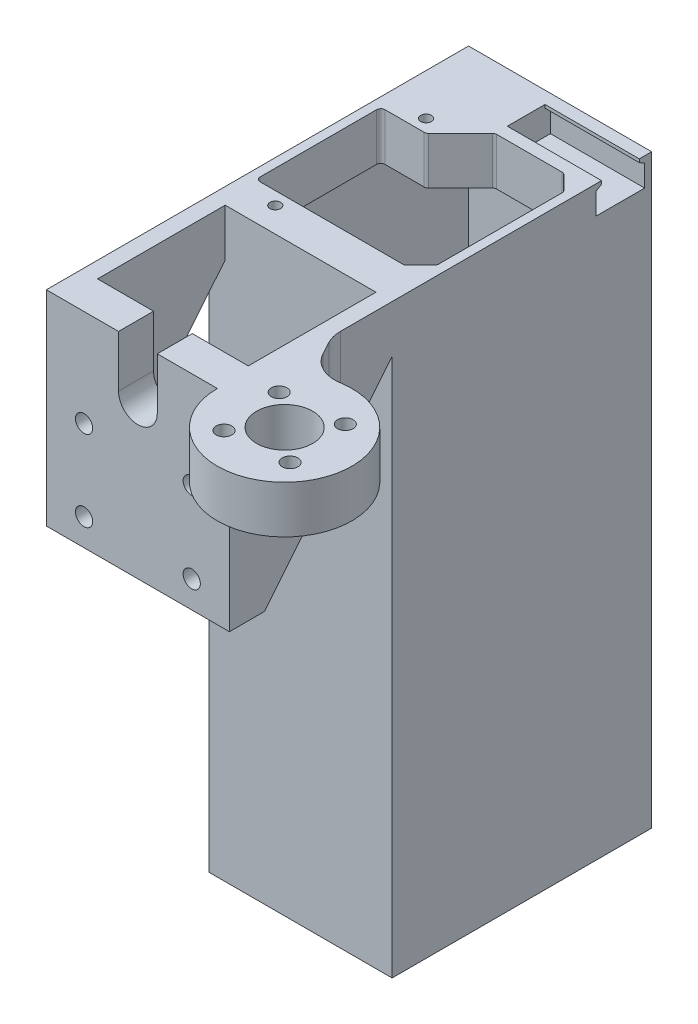
from build123d import *

# Parameters (mm, degrees)
BOSS_EXTRUDE1_START      = -1
SKETCH1_W                = 1.7
SKETCH1_H                = 89.2
BOSS_EXTRUDE1_DEPTH      = 8.8
SKETCH4_W                = 33.7
SKETCH4_H                = 11.6
BOSS_EXTRUDE3_DEPTH      = 8.8
SERVO_HOLDER_DEPTH       = 1
SERVO_HOLDER_DEPTH_BACK  = 8.8
SKETCH3_W                = 14
SKETCH3_H                = 7
SKETCH3_R                = 1
SKETCH37_W               = 20
SKETCH37_H               = 7
BOSS_EXTRUDE19_DEPTH     = 9.8
CUT_EXTRUDE10_DEPTH      = 93.434679639
CUT_EXTRUDE10_DEPTH_BACK = 93.434679639
SKETCH29_W               = 34.409909993
SKETCH29_H               = 6.377389624
BOSS_EXTRUDE13_START     = 2
SKETCH30_W               = 34
SKETCH30_H               = 38
SKETCH30_R               = 1.6
BOSS_EXTRUDE13_DEPTH     = 6.5
SKETCH41_W               = 17.288461538
SKETCH41_H               = 8.8
CUT_EXTRUDE14_DEPTH      = 15
BOSS_EXTRUDE14_START     = -38
SKETCH32_R               = 1.45
SKETCH32_R_2             = 5.2
BOSS_EXTRUDE14_DEPTH     = 8.8
BOSS_EXTRUDE16_DEPTH     = 3
BOSS_EXTRUDE17_DEPTH     = 3
BOSS_EXTRUDE18_DEPTH     = 8.8
SKETCH39_W               = 1.7
SKETCH39_H               = 41.2
BOSS_EXTRUDE20_DEPTH     = 8.8
CUT_EXTRUDE13_DEPTH      = 17.5
CHAMFER2_SIZE            = 0.6
CHAMFER2_SIZE_2          = 1.039230485
CHAMFER3_SIZE            = 3
FILLET10_R               = 6
CUT_EXTRUDE15_DEPTH      = 10
CHAMFER4_SIZE            = 2.5
CUT_EXTRUDE16_DEPTH      = 10
FILLET11_R               = 0.8
SKETCH44_W               = 34
SKETCH44_H               = 48.2
SKETCH44_W_2             = 31.2
SKETCH44_H_2             = 45.4
BOSS_EXTRUDE21_DEPTH     = 100


with BuildPart() as part:
    # Sketch1 → Boss-Extrude1 (new body)
    with BuildSketch(Plane(origin=(0, 0, 0), x_dir=(1, 0, 0), z_dir=(0, 1, 0)).offset(BOSS_EXTRUDE1_START)):
        with Locations((-20.85, 25.311538462)):
            Rectangle(SKETCH1_W, SKETCH1_H)
    extrude(amount=-BOSS_EXTRUDE1_DEPTH)

    # Sketch4 → Boss-Extrude3 (add)
    with BuildSketch(Plane.XZ.offset(9.8)):
        with Locations((-4.85, -64.111538462)):
            Rectangle(SKETCH4_W, SKETCH4_H)
    extrude(amount=-BOSS_EXTRUDE3_DEPTH)

    # Sketch3 → Servo Holder (add, two sides: drawn at the far end of the back side and taken through both)
    # profile 1 of 2: a face of its own
    with BuildSketch(Plane.XZ.offset(9.8).offset(-SERVO_HOLDER_DEPTH_BACK)):
        with Locations((-14.7, -55.411538462)):
            Rectangle(SKETCH3_W, SKETCH3_H)
        with Locations(Location((-14, -54.311538462, 0), (0, 0, 270))):
            Circle(SKETCH3_R, mode=Mode.SUBTRACT)
    # profile 2 of 2: a face of its own
    with BuildSketch(Plane.XZ.offset(9.8).offset(-SERVO_HOLDER_DEPTH_BACK)):
        with Locations((-14.7, -25.211538462)):
            Rectangle(SKETCH3_W, SKETCH3_H)
        with Locations(Location((-14, -26.311538462, 0), (0, 0, 90))):
            Circle(SKETCH3_R, mode=Mode.SUBTRACT)
    extrude(amount=SERVO_HOLDER_DEPTH + SERVO_HOLDER_DEPTH_BACK)

    # Sketch37 → Boss-Extrude19 (add)
    with BuildSketch(Plane(origin=(0, -1, 0), x_dir=(1, 0, 0), z_dir=(0, 1, 0))):
        with Locations((2.3, 25.211538462)):
            Rectangle(SKETCH37_W, SKETCH37_H)
    extrude(amount=-BOSS_EXTRUDE19_DEPTH)

    # Sketch29 → Cut-Extrude10 (cut, two sides: drawn at the far end of the back side and taken through both)
    with BuildSketch(Plane(origin=(0, 0, -69.911538462), x_dir=(-1, 0, 0), z_dir=(0, 0, -1)).offset(-CUT_EXTRUDE10_DEPTH_BACK)):
        with Locations((4.495045004, -12.988694812)):
            Rectangle(SKETCH29_W, SKETCH29_H)
    extrude(amount=CUT_EXTRUDE10_DEPTH + CUT_EXTRUDE10_DEPTH_BACK, mode=Mode.SUBTRACT)


with BuildPart() as body_2:
    # Sketch30 → Boss-Extrude13 (new body)
    with BuildSketch(Plane.XY.offset(BOSS_EXTRUDE13_START)):
        with Locations((-4.7, -20)):
            Rectangle(SKETCH30_W, SKETCH30_H)
        with Locations(Location((5.3, -34, 0), (0, 0, 180))):
            Circle(SKETCH30_R, mode=Mode.SUBTRACT)
        with Locations(Location((5.3, -19, 0), (0, 0, 180))):
            Circle(SKETCH30_R, mode=Mode.SUBTRACT)
        with Locations(Location((-14.7, -34, 0), (0, 0, 180))):
            Circle(SKETCH30_R, mode=Mode.SUBTRACT)
        with Locations(Location((-14.7, -19, 0), (0, 0, 180))):
            Circle(SKETCH30_R, mode=Mode.SUBTRACT)
    extrude(amount=BOSS_EXTRUDE13_DEPTH)


with BuildPart() as cut_extrude14_tool:
    # Sketch41 → Cut-Extrude14 (new body)
    with BuildSketch(Plane(origin=(-20, 0, 0), x_dir=(0, 0, -1), z_dir=(1, 0, 0))):
        with Locations((-10.644230769, -5.4)):
            Rectangle(SKETCH41_W, SKETCH41_H)
    extrude(amount=-CUT_EXTRUDE14_DEPTH)


with BuildPart() as part_1:
    add(part.part)

    # Cut-Extrude14: cut by cut_extrude14_tool
    add(cut_extrude14_tool.part, mode=Mode.SUBTRACT)



with BuildPart() as body_2_1:
    add(body_2.part)

    # Cut-Extrude14: cut by cut_extrude14_tool
    add(cut_extrude14_tool.part, mode=Mode.SUBTRACT)

    # Sketch32 → Boss-Extrude14 (add)
    with BuildSketch(Plane.XZ.offset(39).offset(BOSS_EXTRUDE14_START)):
        with BuildLine():
            ThreePointArc((11.872921748, 2), (25.925390485, -3.535644523), (35.05, 8.5))
            ThreePointArc((35.05, 8.5), (22.55, 21), (10.05, 8.5))
            Line((10.05, 8.5), (12.3, 8.5))
            Line((12.3, 8.5), (12.3, 2))
            Line((12.3, 2), (11.872921748, 2))
        make_face()
        with Locations(Location((16.410078628, 3.371514303, 0), (0, 0, 180))):
            Circle(SKETCH32_R, mode=Mode.SUBTRACT)
        with Locations(Location((27.678485697, 2.360078628, 0), (0, 0, 180))):
            Circle(SKETCH32_R, mode=Mode.SUBTRACT)
        with Locations(Location((17.421514303, 14.639921372, 0), (0, 0, 180))):
            Circle(SKETCH32_R, mode=Mode.SUBTRACT)
        with Locations(Location((22.55, 8.5, 0), (0, 0, 180))):
            Circle(SKETCH32_R_2, mode=Mode.SUBTRACT)
        with Locations(Location((28.689921372, 13.628485697, 0), (0, 0, 180))):
            Circle(SKETCH32_R, mode=Mode.SUBTRACT)
    extrude(amount=BOSS_EXTRUDE14_DEPTH)


with BuildPart() as part_2:
    add(part_1.part)

    add(body_2_1.part)  # Boss-Extrude16 merges body 2
    # Sketch34 → Boss-Extrude16 (add)
    with BuildSketch(Plane.ZY.offset(21.7)):
        Polygon((-21.711538462, -1), (-21.711538462, -9.8), (2, -39), (8.5, -39), (8.5, -1), align=None)
    extrude(amount=-BOSS_EXTRUDE16_DEPTH)

    # Sketch35 → Boss-Extrude17 (add)
    with BuildSketch(Plane(origin=(12.3, 0, 0), x_dir=(0, 0, -1), z_dir=(1, 0, 0))):
        Polygon((-2, -1), (21.711538462, -1), (21.711538462, -9.8), (-2, -39), (-8.5, -39), (-8.5, -9.8), (-8.5, -1), align=None)
    extrude(amount=-BOSS_EXTRUDE17_DEPTH)

    # Sketch36 → Boss-Extrude18 (add)
    with BuildSketch(Plane.XZ.offset(9.8)):
        Polygon((12.3, -10.579162849), (16.63422252, -2.511520186), (12.3, 1.345455989), align=None)
    extrude(amount=-BOSS_EXTRUDE18_DEPTH)

    # Sketch39 → Boss-Extrude20 (add)
    with BuildSketch(Plane(origin=(0, -1, 0), x_dir=(1, 0, 0), z_dir=(0, 1, 0))):
        with Locations((11.45, 49.311538462)):
            Rectangle(SKETCH39_W, SKETCH39_H)
    extrude(amount=-BOSS_EXTRUDE20_DEPTH)

    # Sketch40 → Cut-Extrude13 (cut)
    with BuildSketch(Plane(origin=(12.3, 0, 0), x_dir=(0, 0, -1), z_dir=(1, 0, 0))):
        Polygon((64.111538462, -1), (60.611538462, -1), (60.611538462, -2.2), (59.611538462, -2.2), (59.611538462, -6.2), (64.111538462, -6.2), align=None)
        Polygon((67.611538462, -1), (64.111538462, -1), (64.111538462, -6.2), (68.611538462, -6.2), (68.611538462, -2.2), (67.611538462, -2.2), align=None)
    extrude(amount=-CUT_EXTRUDE13_DEPTH, mode=Mode.SUBTRACT)

    # Chamfer2
    # the kernel refuses this chamfer: 1.039230485, 0.6 mm, written as the material it takes off along each edge
    with BuildSketch(Plane(origin=(14.988578382, -2.2, -67.611538462), x_dir=(0, 0.9983227437537925, 0.05789386240267319), z_dir=(-1, 0, 0))) as chamfer2_piece_1_section:
        Polygon((CHAMFER2_SIZE * 0.998322743754, CHAMFER2_SIZE * 0.0578938624027), (-CHAMFER2_SIZE_2 * 0.0578938623771, CHAMFER2_SIZE_2 * 0.998322743313), (0, 0), align=None)
    chamfer2_piece_1 = extrude(amount=20.188578382, mode=Mode.PRIVATE)
    chamfer2_piece_1 = split(chamfer2_piece_1, bisect_by=Plane(origin=(4.894289191, -2.005782009, -68.611538462), z_dir=(0, 0, 1)), keep=Keep.TOP, mode=Mode.PRIVATE)
    add(chamfer2_piece_1, mode=Mode.SUBTRACT)
    with BuildSketch(Plane(origin=(14.988578382, -2.2, -60.611538462), x_dir=(0, 0.9983227437537925, -0.05789386240267317), z_dir=(-1, 0, 0))) as chamfer2_piece_2_section:
        Polygon((CHAMFER2_SIZE * 0.998322743754, -CHAMFER2_SIZE * 0.0578938624027), (-CHAMFER2_SIZE_2 * 0.0578938623771, -CHAMFER2_SIZE_2 * 0.998322743313), (0, 0), align=None)
    chamfer2_piece_2 = extrude(amount=20.188578382, mode=Mode.PRIVATE)
    chamfer2_piece_2 = split(chamfer2_piece_2, bisect_by=Plane(origin=(4.894289191, -2.005782009, -59.611538462), z_dir=(0, 0, -1)), keep=Keep.TOP, mode=Mode.PRIVATE)
    add(chamfer2_piece_2, mode=Mode.SUBTRACT)

    # Chamfer3
    chamfer3_edges = [part_2.edges().sort_by_distance(p)[0] for p in [
        (10.6, -5.4, -58.311538462),
        (10.6, -5.4, -28.711538462),
    ]]
    chamfer(chamfer3_edges, length=CHAMFER3_SIZE)

    # Fillet10
    fillet10_edges = [part_2.edges().sort_by_distance(p)[0] for p in [
        (16.63422252, -5.4, -2.511520186),
        (12.3, -5.4, -10.579162849),
    ]]
    fillet(fillet10_edges, radius=FILLET10_R)

    # Sketch42 → Cut-Extrude15 (cut)
    with BuildSketch(Plane.XY.offset(8.5)):
        with BuildLine():
            Line((-1.1, -1), (-1.1, -10.6))
            ThreePointArc((-1.1, -10.6), (-4.7, -14.2), (-8.3, -10.6))
            Line((-8.3, -10.6), (-8.3, -1))
            Line((-8.3, -1), (-1.1, -1))
        make_face()
    extrude(amount=-CUT_EXTRUDE15_DEPTH, mode=Mode.SUBTRACT)

    # Chamfer4
    chamfer4_edges = [part_2.edges().sort_by_distance(p)[0] for p in [
        (-7.7, -5.4, -58.311538462),
    ]]
    chamfer(chamfer4_edges, length=CHAMFER4_SIZE)

    # Sketch43 → Cut-Extrude16 (cut)
    with BuildSketch(Plane(origin=(0, -1, 0), x_dir=(1, 0, 0), z_dir=(0, 1, 0))):
        Polygon((-5.2, 58.311538462), (-11.6, 51.911538462), (-5.2, 51.911538462), align=None)
    extrude(amount=-CUT_EXTRUDE16_DEPTH, mode=Mode.SUBTRACT)

    # Fillet11
    fillet11_edges = [part_2.edges().sort_by_distance(p)[0] for p in [
        (-20, -5.4, -28.711538462),
        (-20, -5.4, -51.911538462),
        (10.6, -5.4, -55.311538462),
        (10.6, -5.4, -31.711538462),
        (7.6, -5.4, -28.711538462),
        (7.6, -5.4, -58.311538462),
        (-5.2, -5.4, -58.311538462),
        (-11.6, -5.4, -51.911538462),
    ]]
    fillet(fillet11_edges, radius=FILLET11_R)

    # Sketch44 → Boss-Extrude21 (add)
    with BuildSketch(Plane(origin=(0, -9.8, 0), x_dir=(-1, 0, 0), z_dir=(0, -1, 0))):
        with Locations((4.7, 45.811538462)):
            Rectangle(SKETCH44_W, SKETCH44_H)
        with Locations((4.7, 45.811538462)):
            Rectangle(SKETCH44_W_2, SKETCH44_H_2, mode=Mode.SUBTRACT)
    extrude(amount=BOSS_EXTRUDE21_DEPTH)


solid = part_2.part
